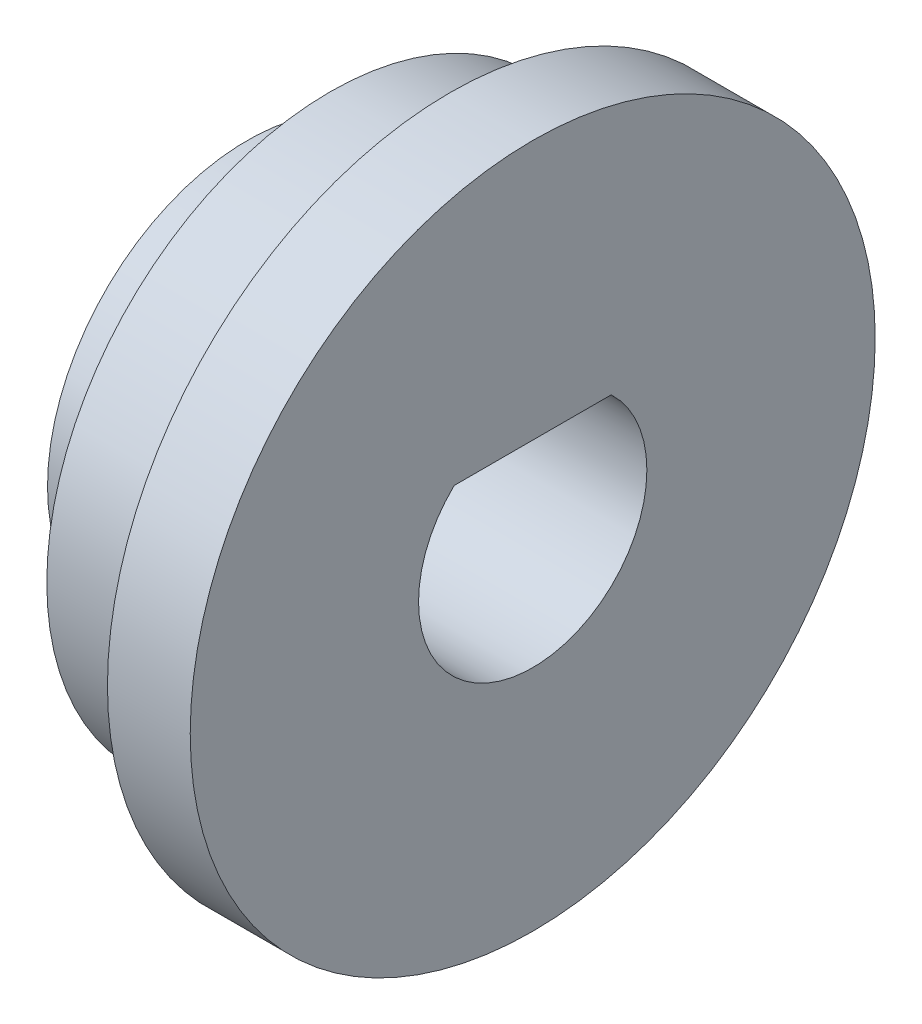
from build123d import *

# Parameters (mm, degrees)
SCHNITT_LINEAR_AUSTRAGEN1_DEPTH = 20.697715604


with BuildPart() as part:
    # Skizze1 → Rotation1 (revolve)
    with BuildSketch(Plane.XY):
        Polygon((0, 0), (0, 7), (2.9, 7), (2.9, 9.925), (7.1, 9.925), (7.1, 12), (10, 12), (10, 0), align=None)
    revolve(axis=Axis((0, 0, 0), (-1, 0, 0)))

    # Skizze2 → Schnitt-Linear austragen1 (cut, through all)
    with BuildSketch(Plane.ZY):
        with BuildLine():
            Line((-2.75, 2.90473751), (2.75, 2.90473751))
            ThreePointArc((2.75, 2.90473751), (0, -4), (-2.75, 2.90473751))
        make_face()
    extrude(amount=-SCHNITT_LINEAR_AUSTRAGEN1_DEPTH, mode=Mode.SUBTRACT)


solid = part.part
